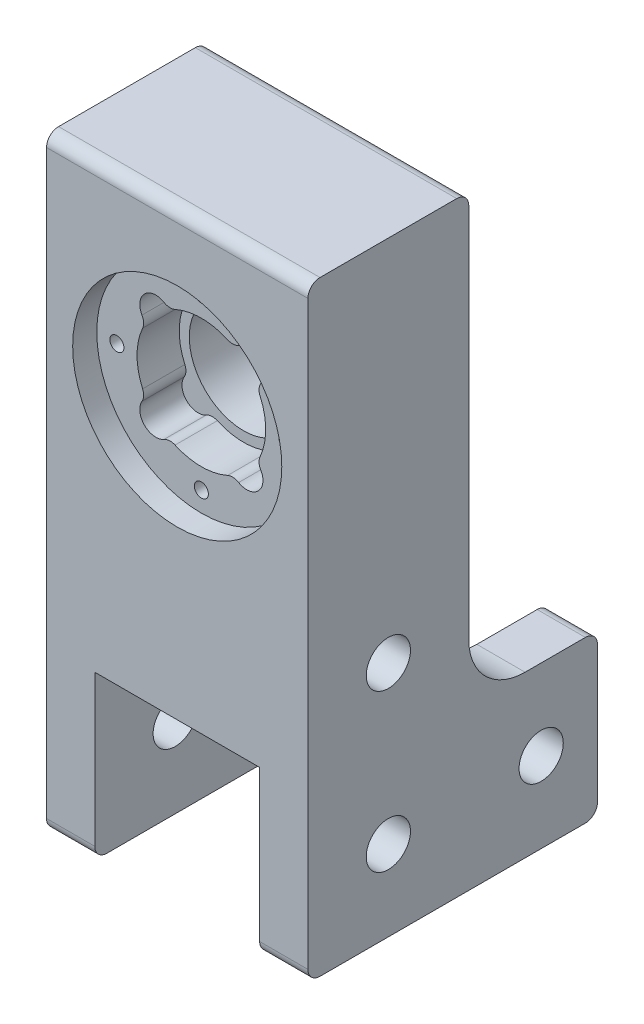
from build123d import *

# Parameters (mm, degrees)
EXTRUDE1_DEPTH      = 10.25
EXTRUDE1_DEPTH_BACK = 10.25
SKETCH1_W           = 20
SKETCH1_H           = 55
EXTRUDE2_DEPTH      = 6
SKETCH4_R           = 2.75
EXTRUDE3_DEPTH      = 78.393878957
SKETCH5_R           = 6.755
EXTRUDE4_DEPTH      = 77.273357078
FILLET2_R           = 1.5
SKETCH_1_W          = 32.5
SKETCH_1_H          = 73.75
CUT_EXTRUDE_1_DEPTH = 77.273357078
SKETCH_2_R          = 13
CUT_EXTRUDE_2_DEPTH = 3
CUT_EXTRUDE_3_DEPTH = 5.25
FILLET_1_R          = 1.5
SKETCH_4_R          = 0.875
CUT_EXTRUDE_4_DEPTH = 8
FILLET_2_R          = 1.5


with BuildPart() as part:
    # Sketch1 → Extrude1 (new, two sides: drawn at the far end of the back side and taken through both)
    with BuildSketch(Plane(origin=(0, 0, 0), x_dir=(0, 0, -1), z_dir=(1, 0, 0)).offset(-EXTRUDE1_DEPTH_BACK)):
        with Locations((0, 37.75)):
            Rectangle(SKETCH1_W, SKETCH1_H)
    extrude(amount=EXTRUDE1_DEPTH + EXTRUDE1_DEPTH_BACK)

    # Sketch2 → Extrude2 (add)
    with BuildSketch(Plane(origin=(10.25, 0, 0), x_dir=(0, 0, -1), z_dir=(1, 0, 0))):
        with BuildLine():
            Line((26, 10), (17, 10))
            ThreePointArc((17, 10), (12.050252532, 12.050252532), (10, 17))
            Line((10, 17), (10, 65.25))
            Line((10, 65.25), (-10, 65.25))
            Line((-10, 65.25), (-10, 17))
            ThreePointArc((-10, 17), (-12.050252532, 12.050252532), (-17, 10))
            Line((-17, 10), (-26, 10))
            Line((-26, 10), (-26, -10))
            Line((-26, -10), (26, -10))
            Line((26, -10), (26, 10))
        make_face()
    extrude2 = extrude(amount=EXTRUDE2_DEPTH)

    # Mirror2: Extrude2 across plane
    add(extrude2.mirror(Plane(origin=(0, 0, 0), x_dir=(0, 0, 1), z_dir=(1, 0, 0))))

    # Sketch4 → Extrude3 (cut, through all)
    with BuildSketch(Plane(origin=(16.25, 0, 0), x_dir=(0, 0, -1), z_dir=(1, 0, 0))):
        Circle(SKETCH4_R)
        with Locations((19, 0)):
            Circle(SKETCH4_R)
        with Locations((-19, 0)):
            Circle(SKETCH4_R)
        with Locations((0, 19.5)):
            Circle(SKETCH4_R)
    extrude(amount=-EXTRUDE3_DEPTH, mode=Mode.SUBTRACT)

    # Sketch5 → Extrude4 (cut, through all)
    with BuildSketch(Plane.XY.offset(10)):
        with Locations((0, 44)):
            Circle(SKETCH5_R)
    extrude(amount=-EXTRUDE4_DEPTH, mode=Mode.SUBTRACT)

    # Fillet2
    fillet2_edges = [part.edges().sort_by_distance(p)[0] for p in [
        (13.25, -10, 26),
        (13.25, 10, 26),
        (-13.25, 10, 26),
        (-13.25, -10, 26),
        (-13.25, -10, -26),
        (13.25, -10, -26),
        (13.25, 10, -26),
        (-13.25, 10, -26),
        (0, 65.25, 10),
        (0, 65.25, -10),
    ]]
    fillet(fillet2_edges, radius=FILLET2_R)

    # Эскиз1 → Вырез-Вытянуть1 (cut, through all)
    with BuildSketch(Plane(origin=(0, 0, 10), x_dir=(-1, 0, 0), z_dir=(0, 0, -1))):
        with Locations((0, 26.875)):
            Rectangle(SKETCH_1_W, SKETCH_1_H)
    extrude(amount=-CUT_EXTRUDE_1_DEPTH, mode=Mode.SUBTRACT)

    # Эскиз2 → Вырез-Вытянуть2 (cut)
    with BuildSketch(Plane.XY.offset(10)):
        with Locations((0, 44)):
            Circle(SKETCH_2_R)
    extrude(amount=-CUT_EXTRUDE_2_DEPTH, mode=Mode.SUBTRACT)

    # Эскиз3 → Вырез-Вытянуть3 (cut)
    with BuildSketch(Plane.XY.offset(7)):
        with BuildLine():
            ThreePointArc((6.883199074, 39.923043966), (8, 44), (6.883199074, 48.076956034))
            ThreePointArc((6.883199074, 48.076956034), (7.071067812, 51.071067812), (4.076956034, 50.883199074))
            ThreePointArc((4.076956034, 50.883199074), (0, 52), (-4.076956034, 50.883199074))
            ThreePointArc((-4.076956034, 50.883199074), (-7.071067812, 51.071067812), (-6.883199074, 48.076956034))
            ThreePointArc((-6.883199074, 48.076956034), (-8, 44), (-6.883199074, 39.923043966))
            ThreePointArc((-6.883199074, 39.923043966), (-7.071067812, 36.928932188), (-4.076956034, 37.116800926))
            ThreePointArc((-4.076956034, 37.116800926), (0, 36), (4.076956034, 37.116800926))
            ThreePointArc((4.076956034, 37.116800926), (7.071067812, 36.928932188), (6.883199074, 39.923043966))
        make_face()
    extrude(amount=-CUT_EXTRUDE_3_DEPTH, mode=Mode.SUBTRACT)

    # Скругление1
    fillet_1_edges = [part.edges().sort_by_distance(p)[0] for p in [
        (6.883199074, 48.076956034, 4.375),
        (6.883199074, 39.923043966, 4.375),
        (4.076956034, 37.116800926, 4.375),
        (-4.076956034, 37.116800926, 4.375),
        (-6.883199074, 39.923043966, 4.375),
        (-6.883199074, 48.076956034, 4.375),
        (4.076956034, 50.883199074, 4.375),
        (-4.076956034, 50.883199074, 4.375),
    ]]
    fillet(fillet_1_edges, radius=FILLET_1_R)

    # Эскиз4 → Вырез-Вытянуть4 (cut)
    with BuildSketch(Plane.XY.offset(7)):
        with Locations((0, 54.5)):
            Circle(SKETCH_4_R)
        with Locations((10.5, 44)):
            Circle(SKETCH_4_R)
        with Locations((0, 33.5)):
            Circle(SKETCH_4_R)
        with Locations((-10.5, 44)):
            Circle(SKETCH_4_R)
    extrude(amount=-CUT_EXTRUDE_4_DEPTH, mode=Mode.SUBTRACT)

    # Скругление2
    fillet_2_edges = [part.edges().sort_by_distance(p)[0] for p in [
        (13.25, -10, 10),
        (-13.25, -10, 10),
    ]]
    fillet(fillet_2_edges, radius=FILLET_2_R)


solid = part.part
